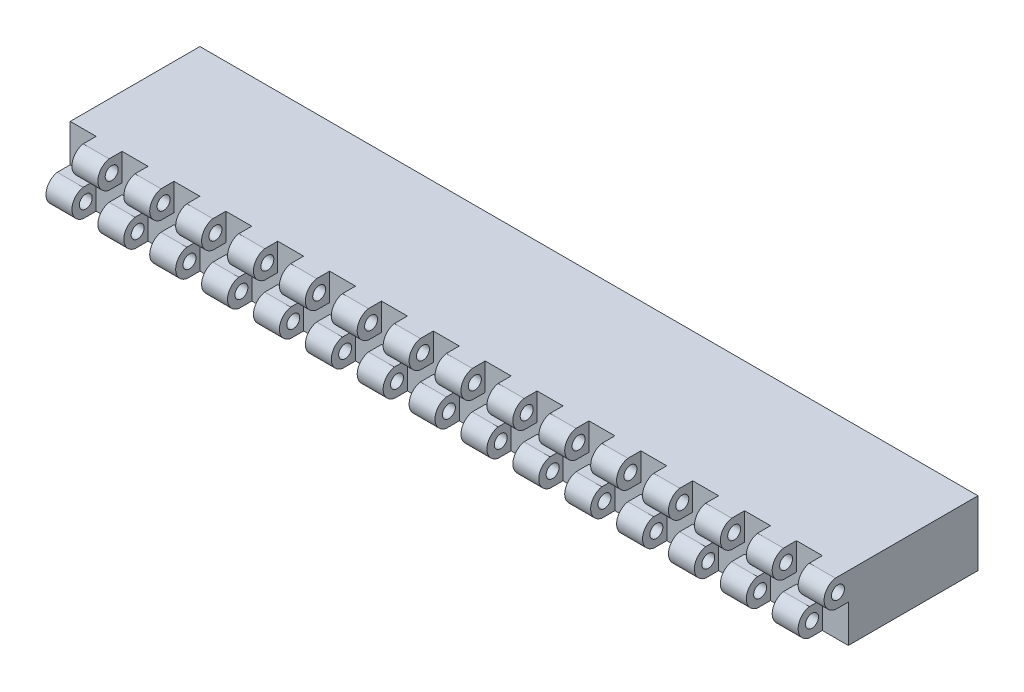
from build123d import *

# Parameters (mm, degrees)
SKETCH1_W           = 50
SKETCH1_H           = 25
BOSS_EXTRUDE1_DEPTH = 150
SKETCH2_R           = 2.5
BOSS_EXTRUDE2_DEPTH = 10
LPATTERN1_COUNT     = 15
LPATTERN1_PITCH     = 20
SKETCH4_R           = 7
CUT_EXTRUDE1_DEPTH  = 30
SKETCH3_R           = 2.5
BOSS_EXTRUDE3_DEPTH = 10
LPATTERN2_COUNT     = 15
LPATTERN2_PITCH     = 20


with BuildPart() as part:
    # Sketch1 → Boss-Extrude1 (new, symmetric)
    with BuildSketch(Plane(origin=(0, 0, 0), x_dir=(0, 0, -1), z_dir=(1, 0, 0))):
        Rectangle(SKETCH1_W, SKETCH1_H)
    extrude(amount=BOSS_EXTRUDE1_DEPTH, both=True)

    # Sketch2 → Boss-Extrude2 (add)
    with BuildSketch(Plane(origin=(150, 0, 0), x_dir=(0, 0, -1), z_dir=(1, 0, 0))):
        with BuildLine():
            Line((-25, 2), (-25, 12.5))
            Line((-25, 12.5), (-30, 12.5))
            ThreePointArc((-30, 12.5), (-34.344389582, 7.25), (-30, 2))
            Line((-30, 2), (-25, 2))
        make_face()
        with Locations((-29, 7.25)):
            Circle(SKETCH2_R, mode=Mode.SUBTRACT)
    boss_extrude2 = extrude(amount=-BOSS_EXTRUDE2_DEPTH)

    # LPattern1: Boss-Extrude2 ×15
    with Locations(*[(-i * LPATTERN1_PITCH, 0, 0) for i in range(1, LPATTERN1_COUNT)]):
        add(boss_extrude2)

    # Sketch4 → Cut-Extrude1 (cut)
    with BuildSketch(Plane(origin=(0, 0, -25), x_dir=(-1, 0, 0), z_dir=(0, 0, -1))):
        Circle(SKETCH4_R)
    extrude(amount=-CUT_EXTRUDE1_DEPTH, mode=Mode.SUBTRACT)

    # Sketch3 → Boss-Extrude3 (add)
    with BuildSketch(Plane.ZY.offset(150)):
        with BuildLine():
            Line((25, -2), (25, -12.5))
            Line((25, -12.5), (30, -12.5))
            ThreePointArc((30, -12.5), (34.344389582, -7.25), (30, -2))
            Line((30, -2), (25, -2))
        make_face()
        with Locations((29, -7.25)):
            Circle(SKETCH3_R, mode=Mode.SUBTRACT)
    boss_extrude3 = extrude(amount=-BOSS_EXTRUDE3_DEPTH)

    # LPattern2: Boss-Extrude3 ×15
    with Locations(*[(i * LPATTERN2_PITCH, 0, 0) for i in range(1, LPATTERN2_COUNT)]):
        add(boss_extrude3)


solid = part.part
